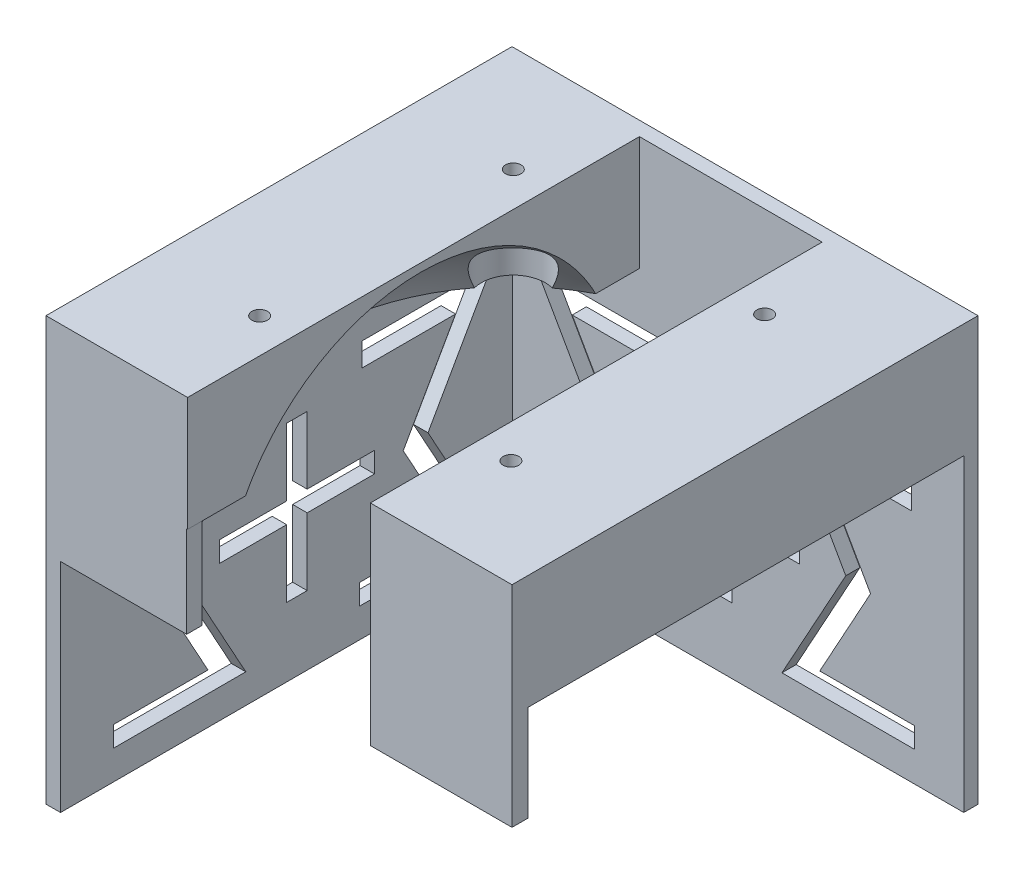
from build123d import *
from build123d.topology import SkipClean

# Parameters (mm, degrees)
SKETCH1_W                   = 102
SKETCH1_H                   = 102
BOSS_EXTRUDE1_DEPTH         = 50
CUT_EXTRUDE_THIN1_OUTLINE_W = 40
CUT_EXTRUDE_THIN1_OUTLINE_H = 95.773670058
CUT_EXTRUDE_THIN1_DEPTH     = 50
SKETCH4_W                   = 40
SKETCH4_H                   = 6.202657501
CUT_EXTRUDE3_DEPTH          = 54
SKETCH5_W                   = 33.817621941
SKETCH5_H                   = 102.594578927
CUT_EXTRUDE4_DEPTH          = 20
SKETCH6_W                   = 27.820383201
SKETCH6_H                   = 98.886835029
CUT_EXTRUDE5_DEPTH          = 20
SKETCH7_W                   = 30.8
SKETCH7_H                   = 3.364819678
BOSS_EXTRUDE2_DEPTH         = 21
SKETCH9_W                   = 31
SKETCH9_H                   = 3.479961613
BOSS_EXTRUDE4_DEPTH         = 21
SKETCH11_W                  = 98.820383201
SKETCH11_H                  = 3.113164971
BOSS_EXTRUDE6_DEPTH         = 47.625
SKETCH14_W                  = 102
SKETCH14_H                  = 5
CUT_EXTRUDE7_DEPTH          = 105
SKETCH17_R                  = 7
CUT_EXTRUDE12_DEPTH         = 20.5
M3_CLEARANCE_HOLE1_D        = 3.4
SKETCH22_W                  = 3.179616799
SKETCH22_H                  = 102
BOSS_EXTRUDE7_DEPTH         = 47.6
CUT_EXTRUDE13_DEPTH         = 5
CUT_EXTRUDE14_DEPTH         = 5
CUT_EXTRUDE16_DEPTH         = 5


# Read off the part's stored shape, not the designer's step: Cut-Extrude-Thin1
with BuildPart() as part:
    # Sketch1 → Boss-Extrude1 (new body)
    with BuildSketch(Plane(origin=(0, 0, 0), x_dir=(1, 0, 0), z_dir=(0, 1, 0))):
        with Locations((-66.567363259, 25.977216604)):
            Rectangle(SKETCH1_W, SKETCH1_H)
    extrude(amount=BOSS_EXTRUDE1_DEPTH)

    # Sketch2 → Cut-Revolve1 (revolve, cut)
    with SkipClean():  # the faces are left unmerged after this step: merging them gives an invalid solid
        with BuildSketch(Plane(origin=(0, 0, 0), x_dir=(1, 0, 0), z_dir=(0, 1, 0))):
            with BuildLine():
                ThreePointArc((-66.567363259, 73.602216604), (-114.192363259, 25.977216604), (-66.567363259, -21.647783396))
                Line((-66.567363259, -21.647783396), (-66.567363259, 73.602216604))
            make_face()
            with BuildLine():
                Line((-66.567363259, 73.602216604), (-66.567363259, -21.647783396))
                ThreePointArc((-66.567363259, -21.647783396), (-32.891402805, -7.69874385), (-18.942363259, 25.977216604))
                ThreePointArc((-18.942363259, 25.977216604), (-32.891402805, 59.653177058), (-66.567363259, 73.602216604))
            make_face()
        revolve(axis=Axis((-66.567363259, 0, 21.647783396), (0, 0, -1)), mode=Mode.SUBTRACT)
    add(part.part.scale(1), mode=Mode.REPLACE)  # the faces are merged on a copy

    # Cut-Extrude-Thin1 outline → Cut-Extrude-Thin1 (cut)
    with BuildSketch(Plane(origin=(0, 0, 0), x_dir=(1, 0, 0), z_dir=(0, 1, 0))):
        with Locations((-66.567363259, 25.977216604)):
            Rectangle(CUT_EXTRUDE_THIN1_OUTLINE_W, CUT_EXTRUDE_THIN1_OUTLINE_H)
    extrude(amount=CUT_EXTRUDE_THIN1_DEPTH, mode=Mode.SUBTRACT)

    # Sketch4 → Cut-Extrude3 (cut)
    with BuildSketch(Plane(origin=(0, 0, 0), x_dir=(1, 0, 0), z_dir=(0, 1, 0))):
        with Locations((-66.567363259, -25.010947176)):
            Rectangle(SKETCH4_W, SKETCH4_H)
    extrude(amount=CUT_EXTRUDE3_DEPTH, mode=Mode.SUBTRACT)

    # Sketch5 → Cut-Extrude4 (cut)
    with BuildSketch(Plane(origin=(0, 0, 0), x_dir=(1, 0, 0), z_dir=(0, 1, 0))):
        with Locations((-29.658552289, 22.56676217)):
            Rectangle(SKETCH5_W, SKETCH5_H)
    extrude(amount=CUT_EXTRUDE4_DEPTH, mode=Mode.SUBTRACT)

    # Sketch6 → Cut-Extrude5 (cut)
    with BuildSketch(Plane(origin=(0, 0, 0), x_dir=(-1, 0, 0), z_dir=(0, -1, 0))):
        with Locations((100.47755486, 24.420634119)):
            Rectangle(SKETCH6_W, SKETCH6_H)
    extrude(amount=-CUT_EXTRUDE5_DEPTH, mode=Mode.SUBTRACT)

    # Sketch7 → Boss-Extrude2 (add)
    with BuildSketch(Plane(origin=(0, 0, 0), x_dir=(1, 0, 0), z_dir=(0, 1, 0))):
        with Locations((-102.167363259, -23.340373557)):
            Rectangle(SKETCH7_W, SKETCH7_H)
    extrude(amount=BOSS_EXTRUDE2_DEPTH)

    # Sketch9 → Boss-Extrude4 (add)
    with BuildSketch(Plane.XZ.offset(-20)):
        with Locations((-31.067363259, 23.28280259)):
            Rectangle(SKETCH9_W, SKETCH9_H)
    extrude(amount=BOSS_EXTRUDE4_DEPTH)

    # Sketch11 → Boss-Extrude6 (add)
    with BuildSketch(Plane.XZ):
        with Locations((-64.97755486, -75.420634119)):
            Rectangle(SKETCH11_W, SKETCH11_H)
    extrude(amount=BOSS_EXTRUDE6_DEPTH)

    # Sketch14 → Cut-Extrude7 (cut)
    with BuildSketch(Plane(origin=(-15.567363259, 0, 0), x_dir=(0, 0, -1), z_dir=(1, 0, 0))):
        with Locations((25.977216604, 47.5)):
            Rectangle(SKETCH14_W, SKETCH14_H)
    extrude(amount=-CUT_EXTRUDE7_DEPTH, mode=Mode.SUBTRACT)

    # Sketch17 → Cut-Extrude12 (cut)
    with BuildSketch(Plane.XZ.offset(-20)):
        with Locations(Location((-94.167363259, 1.657963718, 0), (0, 0, 270))):
            Circle(SKETCH17_R)
        with Locations(Location((-94.167363259, -53.864051633, 0), (0, 0, 284.685382437))):
            Circle(SKETCH17_R)
        with Locations(Location((-39.167363259, 1.657963718, 0), (0, 0, 349.246729183))):
            Circle(SKETCH17_R)
        with Locations(Location((-39.167363259, -53.864051633, 0), (0, 0, 270))):
            Circle(SKETCH17_R)
    extrude(amount=-CUT_EXTRUDE12_DEPTH, mode=Mode.SUBTRACT)

    # M3 Clearance Hole1 (through all)
    with Locations(Plane(origin=(0, 40.5, 0), x_dir=(-1, 0, 0), z_dir=(0, -1, 0))):
        with Locations((94.167363259, -1.657963718), (39.167363259, -1.657963718), (39.167363259, 53.864051633), (94.167363259, 53.864051633)):
            Hole(M3_CLEARANCE_HOLE1_D / 2)

    # Sketch22 → Boss-Extrude7 (add)
    with BuildSketch(Plane.XZ):
        with Locations((-115.97755486, -25.977216604)):
            Rectangle(SKETCH22_W, SKETCH22_H)
    extrude(amount=BOSS_EXTRUDE7_DEPTH)

    # Sketch23 → Cut-Extrude13 (cut)
    with BuildSketch(Plane.XY.offset(-73.864051633)):
        Polygon((-80.20953571, -41.043521661), (-109.215945966, -41.043521661), (-95.243590197, -15.662912687), (-109.215945966, 8.956478339), (-80.850561351, 8.956478339), (-80.850561351, 3.828273211), (-101.283253659, 3.828273211), (-89.824920325, -16.364034482), (-100.932692761, -36.556342174), (-80.20953571, -36.556342174), align=None)
        Polygon((-26.363381864, -41.043521661), (-55.36979212, -41.043521661), (-41.397436351, -15.662912687), (-55.36979212, 8.956478339), (-27.004407505, 8.956478339), (-27.004407505, 3.828273211), (-47.437099813, 3.828273211), (-35.978766479, -16.364034482), (-47.086538915, -36.556342174), (-26.363381864, -36.556342174), align=None)
    extrude(amount=-CUT_EXTRUDE13_DEPTH, mode=Mode.SUBTRACT)

    # Sketch24 → Cut-Extrude14 (cut)
    with BuildSketch(Plane.XY.offset(-73.864051633)):
        Polygon((-70.742432906, -14.032687035), (-70.742432906, 0.710902709), (-66.255253419, 0.710902709), (-66.255253419, -14.032687035), (-51.511663676, -14.032687035), (-51.511663676, -18.519866522), (-66.255253419, -18.519866522), (-66.255253419, -33.263456266), (-70.742432906, -33.263456266), (-70.742432906, -18.519866522), (-85.48602265, -18.519866522), (-85.48602265, -14.032687035), align=None)
    extrude(amount=-CUT_EXTRUDE14_DEPTH, mode=Mode.SUBTRACT)

    # Sketch25 → Cut-Extrude16 (cut)
    with BuildSketch(Plane.ZY.offset(117.567363259)):
        Polygon((-40.375666466, -41.200782652), (-69.382076723, -41.200782652), (-55.409720954, -15.820173678), (-69.382076723, 8.799217348), (-41.016692107, 8.799217348), (-41.016692107, 3.67101222), (-61.449384415, 3.67101222), (-49.991051082, -16.521295473), (-61.098823518, -36.713603165), (-40.375666466, -36.713603165), align=None)
        Polygon((13.47048738, -41.200782652), (-15.535922877, -41.200782652), (-1.563567107, -15.820173678), (-15.535922877, 8.799217348), (12.829461739, 8.799217348), (12.829461739, 3.67101222), (-7.603230569, 3.67101222), (3.855102764, -16.521295473), (-7.252669672, -36.713603165), (13.47048738, -36.713603165), align=None)
        Polygon((-28.964861623, -13.290621763), (-28.964861623, 1.452967981), (-24.477682136, 1.452967981), (-24.477682136, -13.290621763), (-9.734092392, -13.290621763), (-9.734092392, -17.77780125), (-24.477682136, -17.77780125), (-24.477682136, -32.521390994), (-28.964861623, -32.521390994), (-28.964861623, -17.77780125), (-43.708451366, -17.77780125), (-43.708451366, -13.290621763), align=None)
    extrude(amount=-CUT_EXTRUDE16_DEPTH, mode=Mode.SUBTRACT)


solid = part.part
